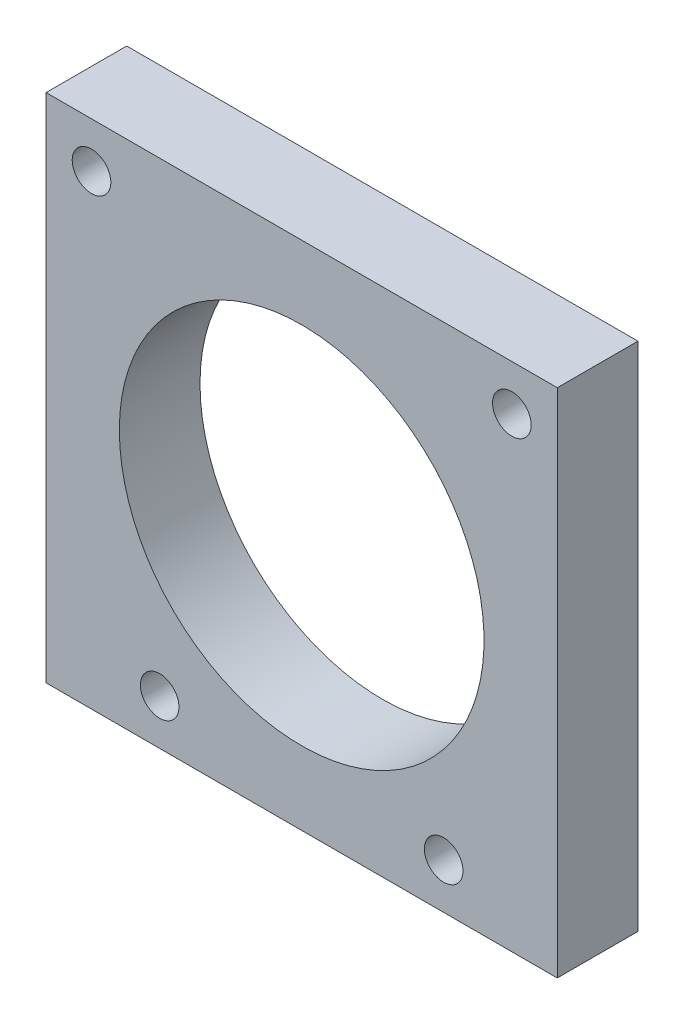
from build123d import *

# Parameters (mm, degrees)
SKETCH1_W                      = 45
SKETCH1_H                      = 45
SKETCH1_R                      = 16
BOSS_EXTRUDE1_DEPTH            = 7.1
M3X0_5_TAPPED_HOLE1_D          = 2.5
M3X0_5_TAPPED_HOLE1_DEPTH      = 15
M3X0_5_TAPPED_HOLE1_TIP        = 0.751075774
CBORE_FOR_M3_SHCS1_D           = 3.4
CBORE_FOR_M3_SHCS1_DEPTH       = 7.1
CBORE_FOR_M3_SHCS1_CBORE_D     = 6.5
CBORE_FOR_M3_SHCS1_CBORE_DEPTH = 3
CBORE_FOR_M3_SHCS1_TIP         = 1.021463052
F_3D_PRINTING_TOLERANCE_BY     = 0.05


with BuildPart() as part:
    # Sketch1 → Boss-Extrude1 (new body)
    with BuildSketch(Plane.XY):
        Rectangle(SKETCH1_W, SKETCH1_H)
        Circle(SKETCH1_R, mode=Mode.SUBTRACT)
    extrude(amount=BOSS_EXTRUDE1_DEPTH)

    # M3x0.5 Tapped Hole1
    with Locations(Plane(origin=(0, 0, 0), x_dir=(-1, 0, 0), z_dir=(0, 0, -1))):
        with Locations((-18.5, 18.5), (18.5, 18.5), (-12.5, -18.5), (12.5, -18.5)):
            Hole(M3X0_5_TAPPED_HOLE1_D / 2, depth=M3X0_5_TAPPED_HOLE1_DEPTH)
            with Locations((0, 0, -(M3X0_5_TAPPED_HOLE1_DEPTH + M3X0_5_TAPPED_HOLE1_TIP / 2))):  # 118° drill point
                Cone(0, M3X0_5_TAPPED_HOLE1_D / 2, M3X0_5_TAPPED_HOLE1_TIP, mode=Mode.SUBTRACT)

    # CBORE for M3 SHCS1
    with Locations(Plane(origin=(0, 0, 0), x_dir=(-1, 0, 0), z_dir=(0, 0, -1))):
        with Locations((-18.5, 18.5), (18.5, 18.5), (12.5, -18.5), (-12.5, -18.5)):
            CounterBoreHole(CBORE_FOR_M3_SHCS1_D / 2, CBORE_FOR_M3_SHCS1_CBORE_D / 2, CBORE_FOR_M3_SHCS1_CBORE_DEPTH, depth=CBORE_FOR_M3_SHCS1_DEPTH)
            with Locations((0, 0, -(CBORE_FOR_M3_SHCS1_DEPTH + CBORE_FOR_M3_SHCS1_TIP / 2))):  # 118° drill point
                Cone(0, CBORE_FOR_M3_SHCS1_D / 2, CBORE_FOR_M3_SHCS1_TIP, mode=Mode.SUBTRACT)

    # 3D Printing Tolerance: a curved face moved inward by 0.05
    add(Solid.thicken(part.faces().sort_by_distance((-16, 0, 3.55))[0], -F_3D_PRINTING_TOLERANCE_BY), mode=Mode.SUBTRACT)


solid = part.part
